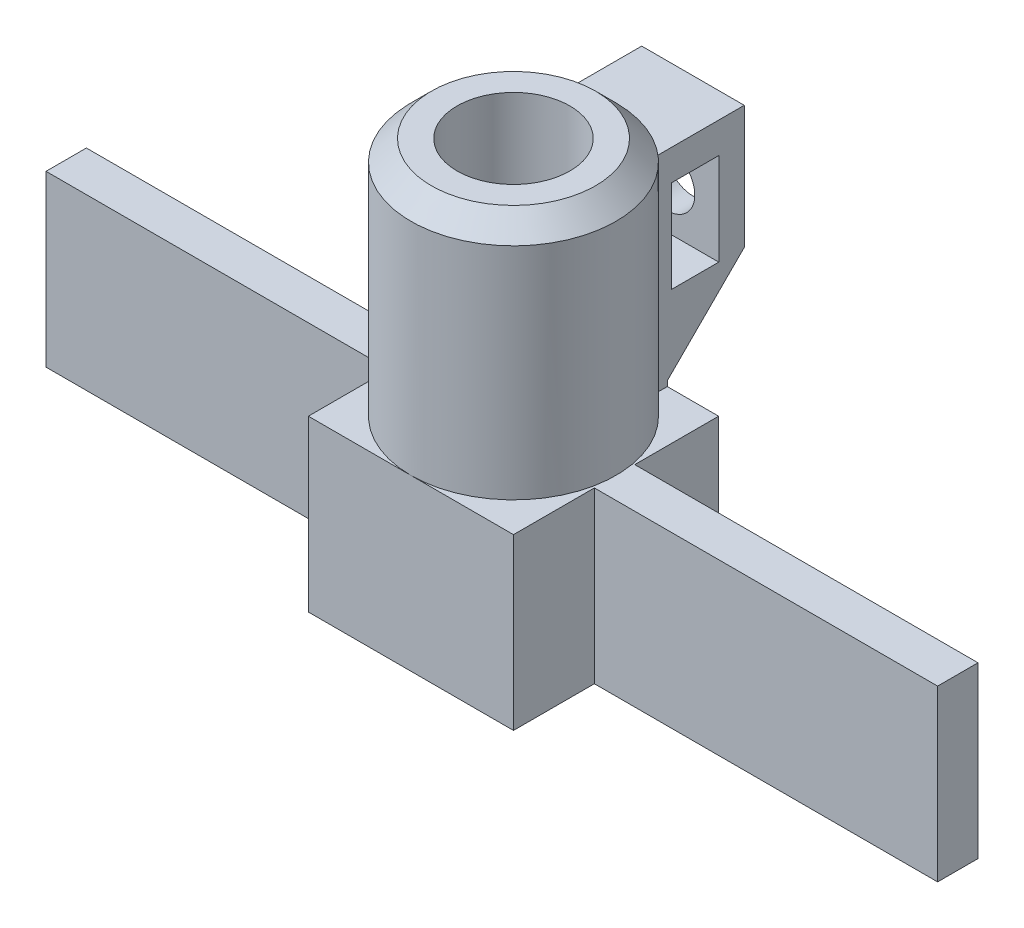
from build123d import *

# Parameters (mm, degrees)
SKETCH1_W                   = 25.4
SKETCH1_H                   = 25.4
BOSS_EXTRUDE1_DEPTH         = 21
SKETCH8_W                   = 2.902818519
SKETCH8_H                   = 9.580147983
BOSS_EXTRUDE4_DEPTH         = 25.4
SKETCH10_R                  = 12.7
BOSS_EXTRUDE5_DEPTH         = 29.7815
SKETCH12_R                  = 6.985
CUT_EXTRUDE2_DEPTH          = 22.9235
CHAMFER1_SIZE               = 2.54
SKETCH14_W                  = 12.7
SKETCH14_H                  = 25.4
BOSS_EXTRUDE6_DEPTH         = 15.24
CUT_EXTRUDE3_REACH          = 60.614
SKETCH18_W                  = 5.842
SKETCH18_H                  = 11.43
F_1_4_CLEARANCE_HOLE2_D     = 6.7564
F_1_4_CLEARANCE_HOLE2_DEPTH = 20.32
F_1_4_CLEARANCE_HOLE2_TIP   = 2.029827343
CHAMFER2_SIZE               = 10.16
SKETCH21_W                  = 5
SKETCH21_H                  = 21
BOSS_EXTRUDE7_DEPTH         = 42.5
SKETCH22_R                  = 2.64
CUT_EXTRUDE4_DEPTH          = 22


with BuildPart() as part:
    # Sketch1 → Boss-Extrude1 (new body)
    with BuildSketch(Plane(origin=(0, 0, 0), x_dir=(1, 0, 0), z_dir=(0, 1, 0))):
        Rectangle(SKETCH1_W, SKETCH1_H)
    extrude(amount=BOSS_EXTRUDE1_DEPTH)

    # Sketch8 → Boss-Extrude4 (add, through all)
    with BuildSketch(Plane.XY.offset(12.7)):
        with Locations((-1.45140926, 4.790073991)):
            Rectangle(SKETCH8_W, SKETCH8_H)
    extrude(amount=-BOSS_EXTRUDE4_DEPTH)

    # Sketch10 → Boss-Extrude5 (add)
    with BuildSketch(Plane(origin=(0, 21, 0), x_dir=(1, 0, 0), z_dir=(0, 1, 0))):
        with Locations(Location((0, 0, 0), (0, 0, 270))):
            Circle(SKETCH10_R)
    extrude(amount=BOSS_EXTRUDE5_DEPTH)

    # Sketch12 → Cut-Extrude2 (cut)
    with BuildSketch(Plane(origin=(0, 50.7815, 0), x_dir=(1, 0, 0), z_dir=(0, 1, 0))):
        with Locations(Location((0, 0, 0), (0, 0, 270))):
            Circle(SKETCH12_R)
    extrude(amount=-CUT_EXTRUDE2_DEPTH, mode=Mode.SUBTRACT)

    # Chamfer1
    chamfer1_edges = [part.edges().sort_by_distance(p)[0] for p in [
        (0, 50.7815, -12.7),
    ]]
    chamfer(chamfer1_edges, length=CHAMFER1_SIZE)

    # Sketch14 → Boss-Extrude6 (add)
    with BuildSketch(Plane.XY.offset(-6.985)):
        with Locations((0, 33.7)):
            Rectangle(SKETCH14_W, SKETCH14_H)
    extrude(amount=-BOSS_EXTRUDE6_DEPTH)

    # Sketch18 → Cut-Extrude3 (cut, up to next)
    with BuildSketch(Plane(origin=(6.35, 0, 0), x_dir=(0, 0, -1), z_dir=(1, 0, 0)), mode=Mode.PRIVATE) as cut_extrude3_sk1:
        with Locations((16.149395763, 36.875)):
            Rectangle(SKETCH18_W, SKETCH18_H)
    cut_extrude3_tool1 = extrude(cut_extrude3_sk1.sketch, amount=-CUT_EXTRUDE3_REACH, mode=Mode.PRIVATE) & part.part
    add(cut_extrude3_tool1.solids().sort_by_distance((6.35, 36.875, -16.149396))[0], mode=Mode.SUBTRACT)

    # 1/4 Clearance Hole2
    with Locations(Plane(origin=(0, 0, -22.225), x_dir=(-1, 0, 0), z_dir=(0, 0, -1))):
        with Locations((0, 36.875)):
            Hole(F_1_4_CLEARANCE_HOLE2_D / 2, depth=F_1_4_CLEARANCE_HOLE2_DEPTH)
            with Locations((0, 0, -(F_1_4_CLEARANCE_HOLE2_DEPTH + F_1_4_CLEARANCE_HOLE2_TIP / 2))):  # 118° drill point
                Cone(0, F_1_4_CLEARANCE_HOLE2_D / 2, F_1_4_CLEARANCE_HOLE2_TIP, mode=Mode.SUBTRACT)

    # Chamfer2
    # the kernel refuses this chamfer: 10.16 mm, written as the material it takes off along each edge
    with BuildSketch(Plane(origin=(32.478299158, 21, -22.225), x_dir=(0, 0.9996219169112968, -0.027495876610586268), z_dir=(-1, 0, 0))) as chamfer2_piece_1_section:
        Polygon((CHAMFER2_SIZE * 0.999621916911, -CHAMFER2_SIZE * 0.0274958766106), (-CHAMFER2_SIZE * 0.0274958766106, -CHAMFER2_SIZE * 0.999621916911), (0, 0), align=None)
    chamfer2_piece_1 = extrude(amount=64.956598315, mode=Mode.PRIVATE)
    chamfer2_piece_1 = split(chamfer2_piece_1, bisect_by=Plane(origin=(0, 24.386079735, -12.7), z_dir=(0, 0, -1)), keep=Keep.TOP, mode=Mode.PRIVATE)
    add(chamfer2_piece_1, mode=Mode.SUBTRACT)

    # Sketch21 → Boss-Extrude7 (add)
    with BuildSketch(Plane(origin=(12.7, 0, 0), x_dir=(0, 0, -1), z_dir=(1, 0, 0))):
        with Locations((-0.183594793, 10.5)):
            Rectangle(SKETCH21_W, SKETCH21_H)
    boss_extrude7 = extrude(amount=BOSS_EXTRUDE7_DEPTH)

    # Sketch22 → Cut-Extrude4 (cut)
    with BuildSketch(Plane(origin=(0, 0, 0), x_dir=(-1, 0, 0), z_dir=(0, -1, 0))):
        with Locations(Location((0, 0, 0), (0, 0, 90))):
            Circle(SKETCH22_R)
    extrude(amount=-CUT_EXTRUDE4_DEPTH, mode=Mode.SUBTRACT)

    # Mirror1: Boss-Extrude7 across plane
    add(boss_extrude7.mirror(Plane(origin=(0, 0, 0), x_dir=(0, 0, 1), z_dir=(1, 0, 0))))


solid = part.part
